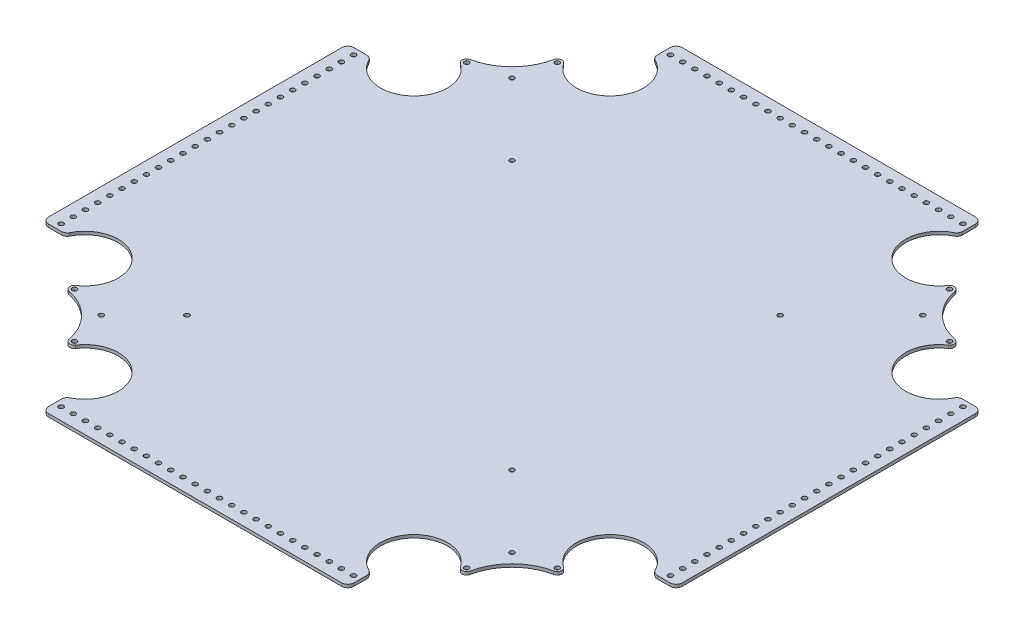
from build123d import *

# Parameters (mm, degrees)
SKETCH1_W                 = 660.4
SKETCH1_H                 = 660.4
BOSS_EXTRUDE1_DEPTH       = 1.5875
SKETCH2_R                 = 2.4892
CUT_EXTRUDE1_DEPTH        = 467.984111748
LPATTERN1_COUNT           = 51
LPATTERN1_PITCH           = 12.7
LPATTERN1_COL_COUNT       = 51
LPATTERN1_COL_PITCH       = 12.7
LPATTERN2_START           = -1.5875
LPATTERN2_OUTLINE_R       = 2.4892
LPATTERN2_DEPTH           = 3.175
LPATTERN3_START           = -1.5875
LPATTERN3_OUTLINE_R       = 2.4892
LPATTERN3_DEPTH           = 3.175
SKETCH4_R                 = 55.5625
SKETCH4_R_2               = 34.925
CUT_EXTRUDE2_DEPTH        = 467.984111748
MIRROR3_COPY_1_SKETCH_R   = 55.5625
MIRROR3_COPY_1_SKETCH_R_2 = 34.925
MIRROR3_COPY_1_DEPTH      = 467.984111748
FILLET1_R                 = 6.35
SKETCH5_R                 = 2.4892
CUT_EXTRUDE3_DEPTH        = 467.984111748
CUT_EXTRUDE4_DEPTH        = 467.984111748
CUT_EXTRUDE4_DEPTH_BACK   = 467.984111748
SKETCH6_R                 = 2.4892


# Read off the part's stored shape, not the designer's step: LPattern2, LPattern3
with BuildPart() as part:
    # Sketch1 → Boss-Extrude1 (new, symmetric)
    with BuildSketch(Plane(origin=(0, 0, 0), x_dir=(1, 0, 0), z_dir=(0, 1, 0))):
        Rectangle(SKETCH1_W, SKETCH1_H)
    extrude(amount=BOSS_EXTRUDE1_DEPTH, both=True)

    # Sketch2 → Cut-Extrude1 (cut, through all)
    with BuildSketch(Plane(origin=(0, 1.5875, 0), x_dir=(1, 0, 0), z_dir=(0, 1, 0))):
        with Locations(Location((-317.5, -317.5, 0), (0, 0, 270))):
            Circle(SKETCH2_R)
    cut_extrude1 = extrude(amount=-CUT_EXTRUDE1_DEPTH, mode=Mode.SUBTRACT)

    # LPattern1: Cut-Extrude1 ×51
    with Locations(*[(0, 0, -i * LPATTERN1_PITCH) for i in range(1, LPATTERN1_COUNT)]):
        add(cut_extrude1, mode=Mode.SUBTRACT)

    # LPattern1 col: Cut-Extrude1 ×51
    with Locations(*[(i * LPATTERN1_COL_PITCH, 0, 0) for i in range(1, LPATTERN1_COL_COUNT)]):
        add(cut_extrude1, mode=Mode.SUBTRACT)

    # LPattern2 outline → LPattern2 (cut)
    with BuildSketch(Plane(origin=(0, 0, 0), x_dir=(1, 0, 0), z_dir=(0, 1, 0)).offset(LPATTERN2_START)):
        with Locations((317.5, 317.5)):
            Circle(LPATTERN2_OUTLINE_R)
        with Locations((317.5, 304.8)):
            Circle(LPATTERN2_OUTLINE_R)
        with Locations((317.5, 292.1)):
            Circle(LPATTERN2_OUTLINE_R)
        with Locations((317.5, 279.4)):
            Circle(LPATTERN2_OUTLINE_R)
        with Locations((317.5, 266.7)):
            Circle(LPATTERN2_OUTLINE_R)
        with Locations((317.5, 254)):
            Circle(LPATTERN2_OUTLINE_R)
        with Locations((317.5, 241.3)):
            Circle(LPATTERN2_OUTLINE_R)
        with Locations((317.5, 228.6)):
            Circle(LPATTERN2_OUTLINE_R)
        with Locations((317.5, 215.9)):
            Circle(LPATTERN2_OUTLINE_R)
        with Locations((317.5, 203.2)):
            Circle(LPATTERN2_OUTLINE_R)
        with Locations((317.5, 190.5)):
            Circle(LPATTERN2_OUTLINE_R)
        with Locations((317.5, 177.8)):
            Circle(LPATTERN2_OUTLINE_R)
        with Locations((317.5, 165.1)):
            Circle(LPATTERN2_OUTLINE_R)
        with Locations((317.5, 152.4)):
            Circle(LPATTERN2_OUTLINE_R)
        with Locations((317.5, 139.7)):
            Circle(LPATTERN2_OUTLINE_R)
        with Locations((317.5, 127)):
            Circle(LPATTERN2_OUTLINE_R)
        with Locations((317.5, 114.3)):
            Circle(LPATTERN2_OUTLINE_R)
        with Locations((317.5, 101.6)):
            Circle(LPATTERN2_OUTLINE_R)
        with Locations((317.5, 88.9)):
            Circle(LPATTERN2_OUTLINE_R)
        with Locations((317.5, 76.2)):
            Circle(LPATTERN2_OUTLINE_R)
        with Locations((317.5, 63.5)):
            Circle(LPATTERN2_OUTLINE_R)
        with Locations((317.5, 50.8)):
            Circle(LPATTERN2_OUTLINE_R)
        with Locations((317.5, 38.1)):
            Circle(LPATTERN2_OUTLINE_R)
        with Locations((317.5, 25.4)):
            Circle(LPATTERN2_OUTLINE_R)
        with Locations((317.5, 12.7)):
            Circle(LPATTERN2_OUTLINE_R)
        with Locations((317.5, 0)):
            Circle(LPATTERN2_OUTLINE_R)
        with Locations((317.5, -12.7)):
            Circle(LPATTERN2_OUTLINE_R)
        with Locations((317.5, -25.4)):
            Circle(LPATTERN2_OUTLINE_R)
        with Locations((317.5, -38.1)):
            Circle(LPATTERN2_OUTLINE_R)
        with Locations((317.5, -50.8)):
            Circle(LPATTERN2_OUTLINE_R)
        with Locations((317.5, -63.5)):
            Circle(LPATTERN2_OUTLINE_R)
        with Locations((317.5, -76.2)):
            Circle(LPATTERN2_OUTLINE_R)
        with Locations((317.5, -88.9)):
            Circle(LPATTERN2_OUTLINE_R)
        with Locations((317.5, -101.6)):
            Circle(LPATTERN2_OUTLINE_R)
        with Locations((317.5, -114.3)):
            Circle(LPATTERN2_OUTLINE_R)
        with Locations((317.5, -127)):
            Circle(LPATTERN2_OUTLINE_R)
        with Locations((317.5, -139.7)):
            Circle(LPATTERN2_OUTLINE_R)
        with Locations((317.5, -152.4)):
            Circle(LPATTERN2_OUTLINE_R)
        with Locations((317.5, -165.1)):
            Circle(LPATTERN2_OUTLINE_R)
        with Locations((317.5, -177.8)):
            Circle(LPATTERN2_OUTLINE_R)
        with Locations((317.5, -190.5)):
            Circle(LPATTERN2_OUTLINE_R)
        with Locations((317.5, -203.2)):
            Circle(LPATTERN2_OUTLINE_R)
        with Locations((317.5, -215.9)):
            Circle(LPATTERN2_OUTLINE_R)
        with Locations((317.5, -228.6)):
            Circle(LPATTERN2_OUTLINE_R)
        with Locations((317.5, -241.3)):
            Circle(LPATTERN2_OUTLINE_R)
        with Locations((317.5, -254)):
            Circle(LPATTERN2_OUTLINE_R)
        with Locations((317.5, -266.7)):
            Circle(LPATTERN2_OUTLINE_R)
        with Locations((317.5, -279.4)):
            Circle(LPATTERN2_OUTLINE_R)
        with Locations((317.5, -292.1)):
            Circle(LPATTERN2_OUTLINE_R)
        with Locations((317.5, -304.8)):
            Circle(LPATTERN2_OUTLINE_R)
    extrude(amount=LPATTERN2_DEPTH, mode=Mode.SUBTRACT)

    # LPattern3 outline → LPattern3 (cut)
    with BuildSketch(Plane(origin=(0, 0, 0), x_dir=(1, 0, 0), z_dir=(0, 1, 0)).offset(LPATTERN3_START)):
        with Locations((304.8, 317.5)):
            Circle(LPATTERN3_OUTLINE_R)
        with Locations((292.1, 317.5)):
            Circle(LPATTERN3_OUTLINE_R)
        with Locations((279.4, 317.5)):
            Circle(LPATTERN3_OUTLINE_R)
        with Locations((266.7, 317.5)):
            Circle(LPATTERN3_OUTLINE_R)
        with Locations((254, 317.5)):
            Circle(LPATTERN3_OUTLINE_R)
        with Locations((241.3, 317.5)):
            Circle(LPATTERN3_OUTLINE_R)
        with Locations((228.6, 317.5)):
            Circle(LPATTERN3_OUTLINE_R)
        with Locations((215.9, 317.5)):
            Circle(LPATTERN3_OUTLINE_R)
        with Locations((203.2, 317.5)):
            Circle(LPATTERN3_OUTLINE_R)
        with Locations((190.5, 317.5)):
            Circle(LPATTERN3_OUTLINE_R)
        with Locations((177.8, 317.5)):
            Circle(LPATTERN3_OUTLINE_R)
        with Locations((165.1, 317.5)):
            Circle(LPATTERN3_OUTLINE_R)
        with Locations((152.4, 317.5)):
            Circle(LPATTERN3_OUTLINE_R)
        with Locations((139.7, 317.5)):
            Circle(LPATTERN3_OUTLINE_R)
        with Locations((127, 317.5)):
            Circle(LPATTERN3_OUTLINE_R)
        with Locations((114.3, 317.5)):
            Circle(LPATTERN3_OUTLINE_R)
        with Locations((101.6, 317.5)):
            Circle(LPATTERN3_OUTLINE_R)
        with Locations((88.9, 317.5)):
            Circle(LPATTERN3_OUTLINE_R)
        with Locations((76.2, 317.5)):
            Circle(LPATTERN3_OUTLINE_R)
        with Locations((63.5, 317.5)):
            Circle(LPATTERN3_OUTLINE_R)
        with Locations((50.8, 317.5)):
            Circle(LPATTERN3_OUTLINE_R)
        with Locations((38.1, 317.5)):
            Circle(LPATTERN3_OUTLINE_R)
        with Locations((25.4, 317.5)):
            Circle(LPATTERN3_OUTLINE_R)
        with Locations((12.7, 317.5)):
            Circle(LPATTERN3_OUTLINE_R)
        with Locations((0, 317.5)):
            Circle(LPATTERN3_OUTLINE_R)
        with Locations((-12.7, 317.5)):
            Circle(LPATTERN3_OUTLINE_R)
        with Locations((-25.4, 317.5)):
            Circle(LPATTERN3_OUTLINE_R)
        with Locations((-38.1, 317.5)):
            Circle(LPATTERN3_OUTLINE_R)
        with Locations((-50.8, 317.5)):
            Circle(LPATTERN3_OUTLINE_R)
        with Locations((-63.5, 317.5)):
            Circle(LPATTERN3_OUTLINE_R)
        with Locations((-76.2, 317.5)):
            Circle(LPATTERN3_OUTLINE_R)
        with Locations((-88.9, 317.5)):
            Circle(LPATTERN3_OUTLINE_R)
        with Locations((-101.6, 317.5)):
            Circle(LPATTERN3_OUTLINE_R)
        with Locations((-114.3, 317.5)):
            Circle(LPATTERN3_OUTLINE_R)
        with Locations((-127, 317.5)):
            Circle(LPATTERN3_OUTLINE_R)
        with Locations((-139.7, 317.5)):
            Circle(LPATTERN3_OUTLINE_R)
        with Locations((-152.4, 317.5)):
            Circle(LPATTERN3_OUTLINE_R)
        with Locations((-165.1, 317.5)):
            Circle(LPATTERN3_OUTLINE_R)
        with Locations((-177.8, 317.5)):
            Circle(LPATTERN3_OUTLINE_R)
        with Locations((-190.5, 317.5)):
            Circle(LPATTERN3_OUTLINE_R)
        with Locations((-203.2, 317.5)):
            Circle(LPATTERN3_OUTLINE_R)
        with Locations((-215.9, 317.5)):
            Circle(LPATTERN3_OUTLINE_R)
        with Locations((-228.6, 317.5)):
            Circle(LPATTERN3_OUTLINE_R)
        with Locations((-241.3, 317.5)):
            Circle(LPATTERN3_OUTLINE_R)
        with Locations((-254, 317.5)):
            Circle(LPATTERN3_OUTLINE_R)
        with Locations((-266.7, 317.5)):
            Circle(LPATTERN3_OUTLINE_R)
        with Locations((-279.4, 317.5)):
            Circle(LPATTERN3_OUTLINE_R)
        with Locations((-292.1, 317.5)):
            Circle(LPATTERN3_OUTLINE_R)
        with Locations((-304.8, 317.5)):
            Circle(LPATTERN3_OUTLINE_R)
    extrude(amount=LPATTERN3_DEPTH, mode=Mode.SUBTRACT)

    # Sketch4 → Cut-Extrude2 (cut, through all)
    with BuildSketch(Plane(origin=(0, -1.5875, 0), x_dir=(-1, 0, 0), z_dir=(0, -1, 0))):
        with BuildLine():
            Line((-330.2, 330.2), (-330.2, 159.131))
            Line((-330.2, 159.131), (-306.365236596, 159.131))
            ThreePointArc((-306.365236596, 159.131), (-295.372166345, 198.825581107), (-254.215318507, 200.444605146))
            ThreePointArc((-254.215318507, 200.444605146), (-256.231826313, 205.325144056), (-252.504938628, 209.066303232))
            ThreePointArc((-252.504938628, 209.066303232), (-306.533682648, 298.702331098), (-207.9625, 263.525))
            ThreePointArc((-207.9625, 263.525), (-208.239139487, 257.987398213), (-209.066303232, 252.504938628))
            ThreePointArc((-209.066303232, 252.504938628), (-205.325144056, 256.231826313), (-200.444605146, 254.215318507))
            ThreePointArc((-200.444605146, 254.215318507), (-198.825581107, 295.372166345), (-159.131, 306.365236596))
            Line((-159.131, 306.365236596), (-159.131, 330.2))
            Line((-159.131, 330.2), (-330.2, 330.2))
        make_face()
        with Locations((-263.525, 263.525)):
            Circle(SKETCH4_R)
        with Locations((-273.685, 171.45)):
            Circle(SKETCH4_R_2)
        with Locations((-171.45, 273.685)):
            Circle(SKETCH4_R_2)
    cut_extrude2 = extrude(amount=-CUT_EXTRUDE2_DEPTH, mode=Mode.SUBTRACT)

    # Mirror2: Cut-Extrude2 across plane
    add(cut_extrude2.mirror(Plane(origin=(0, 0, 0), x_dir=(0, 0, 1), z_dir=(1, 0, 0))), mode=Mode.SUBTRACT)

    # Mirror3: Cut-Extrude2 across plane
    add(cut_extrude2.mirror(Plane.XY), mode=Mode.SUBTRACT)

    # Mirror3 copy 1 sketch → Mirror3 copy 1 (cut, through all)
    with BuildSketch(Plane.XZ.offset(1.5875)):
        with BuildLine():
            Line((-330.2, 330.2), (-330.2, 159.131))
            Line((-330.2, 159.131), (-306.365236596, 159.131))
            ThreePointArc((-306.365236596, 159.131), (-295.372166345, 198.825581107), (-254.215318507, 200.444605146))
            ThreePointArc((-254.215318507, 200.444605146), (-256.231826313, 205.325144056), (-252.504938628, 209.066303232))
            ThreePointArc((-252.504938628, 209.066303232), (-306.533682648, 298.702331098), (-207.9625, 263.525))
            ThreePointArc((-207.9625, 263.525), (-208.239139487, 257.987398213), (-209.066303232, 252.504938628))
            ThreePointArc((-209.066303232, 252.504938628), (-205.325144056, 256.231826313), (-200.444605146, 254.215318507))
            ThreePointArc((-200.444605146, 254.215318507), (-198.825581107, 295.372166345), (-159.131, 306.365236596))
            Line((-159.131, 306.365236596), (-159.131, 330.2))
            Line((-159.131, 330.2), (-330.2, 330.2))
        make_face()
        with Locations((-263.525, 263.525)):
            Circle(MIRROR3_COPY_1_SKETCH_R)
        with Locations((-273.685, 171.45)):
            Circle(MIRROR3_COPY_1_SKETCH_R_2)
        with Locations((-171.45, 273.685)):
            Circle(MIRROR3_COPY_1_SKETCH_R_2)
    extrude(amount=-MIRROR3_COPY_1_DEPTH, mode=Mode.SUBTRACT)

    # Fillet1
    fillet1_edges = [part.edges().sort_by_distance(p)[0] for p in [
        (306.365236596, 0, -159.131),
        (330.2, 0, -159.131),
        (159.131, 0, -330.2),
        (159.131, 0, -306.365236596),
        (-159.131, 0, -306.365236596),
        (-159.131, 0, -330.2),
        (-330.2, 0, -159.131),
        (-306.365236596, 0, -159.131),
        (159.131, 0, 306.365236596),
        (159.131, 0, 330.2),
        (330.2, 0, 159.131),
        (306.365236596, 0, 159.131),
        (-306.365236596, 0, 159.131),
        (-330.2, 0, 159.131),
        (-159.131, 0, 330.2),
        (-159.131, 0, 306.365236596),
    ]]
    fillet(fillet1_edges, radius=FILLET1_R)

    # Sketch5 → Cut-Extrude3 (cut, through all)
    with BuildSketch(Plane.XZ.offset(1.5875)):
        with Locations(Location((139.7, 139.7, 0), (0, 0, 270))):
            Circle(SKETCH5_R)
        with Locations(Location((139.7, -139.7, 0), (0, 0, 270))):
            Circle(SKETCH5_R)
        with Locations(Location((-139.7, -139.7, 0), (0, 0, 270))):
            Circle(SKETCH5_R)
        with Locations(Location((-169.333333333, 169.333333333, 0), (0, 0, 270))):
            Circle(SKETCH5_R)
    extrude(amount=-CUT_EXTRUDE3_DEPTH, mode=Mode.SUBTRACT)

    # Sketch6 → Cut-Extrude4 (cut, two sides: drawn at the far end of the back side and taken through both)
    with BuildSketch(Plane(origin=(0, 1.5875, 0), x_dir=(1, 0, 0), z_dir=(0, 1, 0)).offset(-CUT_EXTRUDE4_DEPTH_BACK)):
        with Locations(Location((-251.560361939, -204.398414938, 0), (0, 0, 270))):
            Circle(SKETCH6_R)
        with Locations(Location((-204.398414938, -251.560361939, 0), (0, 0, 270))):
            Circle(SKETCH6_R)
        with Locations(Location((-214.067153714, -214.067153714, 0), (0, 0, 270))):
            Circle(SKETCH6_R)
        with Locations(Location((214.067153714, -214.067153714, 0), (0, 0, 90))):
            Circle(SKETCH6_R)
        with Locations(Location((204.398414938, -251.560361939, 0), (0, 0, 90))):
            Circle(SKETCH6_R)
        with Locations(Location((251.560361939, -204.398414938, 0), (0, 0, 90))):
            Circle(SKETCH6_R)
        with Locations(Location((251.560361939, 204.398414938, 0), (0, 0, 270))):
            Circle(SKETCH6_R)
        with Locations(Location((204.398414938, 251.560361939, 0), (0, 0, 270))):
            Circle(SKETCH6_R)
        with Locations(Location((214.067153714, 214.067153714, 0), (0, 0, 270))):
            Circle(SKETCH6_R)
        with Locations(Location((-214.067153714, 214.067153714, 0), (0, 0, 90))):
            Circle(SKETCH6_R)
        with Locations(Location((-204.398414938, 251.560361939, 0), (0, 0, 90))):
            Circle(SKETCH6_R)
        with Locations(Location((-251.560361939, 204.398414938, 0), (0, 0, 90))):
            Circle(SKETCH6_R)
    extrude(amount=CUT_EXTRUDE4_DEPTH + CUT_EXTRUDE4_DEPTH_BACK, mode=Mode.SUBTRACT)


solid = part.part
